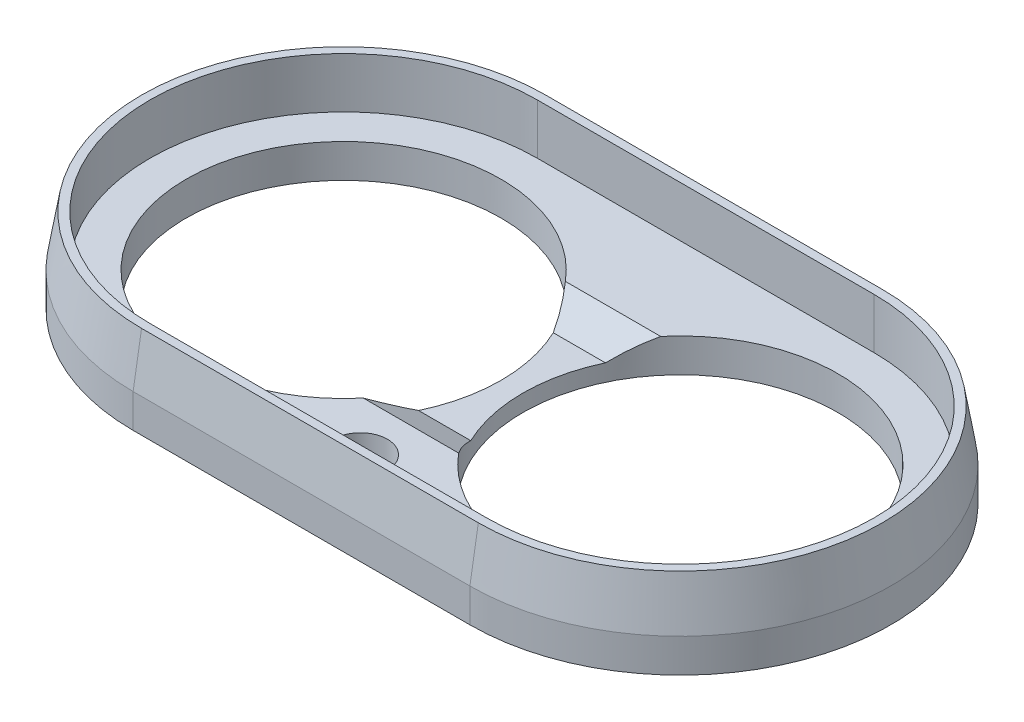
from build123d import *
from OCP.BRepFilletAPI import BRepFilletAPI_MakeChamfer

# Parameters (mm, degrees)
BOSS_EXTRUDE1_DEPTH = 2
SKETCH2_R           = 9.349999999999996
CUT_EXTRUDE1_DEPTH  = 26.81666128685116
BOSS_EXTRUDE2_DEPTH = 3
CHAMFER1_SIZE       = 3
CHAMFER1_SIZE2      = 0.5
SKETCH4_W           = 15.000000000000002
SKETCH4_H           = 12
CUT_EXTRUDE2_DEPTH  = 1
CHAMFER2_SIZE       = 1
CHAMFER2_SIZE_2     = 2
SKETCH5_R           = 1.6000000000000005
SKETCH5_R_2         = 0.75
SKETCH5_R_3         = 0.7500000000000004
CUT_EXTRUDE3_DEPTH  = 27.22022120425378


with BuildPart() as part:
    # Sketch1 → Boss-Extrude1 (new body)
    with BuildSketch(Plane(origin=(0, 0, 0), x_dir=(1, 0, 0), z_dir=(0, 1, 0))):
        with BuildLine():
            Line((-22.5, 0), (-10, 0))
            Line((-10, 0), (1.421e-14, 0))
            Line((1.351e-14, 0), (-3.6e-16, 12.499999999999996))
            Line((0, 12.499999999999996), (-9.999999999999998, 12.499999999999996))
            ThreePointArc((-10.000000000000007, 12.499999999999996), (-18.83883476483184, 8.83883476483184), (-22.499999999999993, 7.9e-16))
        make_face()
        with BuildLine():
            Line((1.421e-14, 0), (-10, 0))
            Line((-10, 0), (-22.5, 0))
            ThreePointArc((-22.499999999999993, 7.9e-16), (-18.83883476483183, -8.83883476483185), (-9.999999999999972, -12.499999999999993))
            Line((-9.999999999999973, -12.499999999999996), (2.665e-14, -12.499999999999996))
            Line((2.739e-14, -12.499999999999996), (1.351e-14, 0))
        make_face()
        with BuildLine():
            Line((10, 0), (1.421e-14, 0))
            Line((1.351e-14, 0), (2.739e-14, -12.499999999999996))
            Line((2.665e-14, -12.499999999999996), (10.000000000000012, -12.499999999999996))
            ThreePointArc((10.000000000000012, -12.499999999999995), (18.838834764831844, -8.838834764831835), (22.499999999999993, 1.01e-15))
            Line((22.5, 0), (10, 0))
        make_face()
        with BuildLine():
            Line((-3.6e-16, 12.499999999999996), (1.351e-14, 0))
            Line((1.421e-14, 0), (10, 0))
            Line((10, 0), (22.5, 0))
            ThreePointArc((22.499999999999993, 1.01e-15), (18.83883476483184, 8.83883476483184), (10, 12.499999999999995))
            Line((9.999999999999998, 12.499999999999996), (0, 12.499999999999996))
        make_face()
    extrude(amount=BOSS_EXTRUDE1_DEPTH)

    # Sketch2 → Cut-Extrude1 (cut, through all)
    with BuildSketch(Plane(origin=(0, 2, 0), x_dir=(1, 0, 0), z_dir=(0, 1, 0))):
        with Locations(Location((10, 0, 0), (0, 0, 270))):
            Circle(SKETCH2_R)
        with Locations(Location((-10, 0, 0), (0, 0, 90))):
            Circle(SKETCH2_R)
    extrude(amount=-CUT_EXTRUDE1_DEPTH, mode=Mode.SUBTRACT)

    # Sketch3 → Boss-Extrude2 (add)
    with BuildSketch(Plane(origin=(0, 2, 0), x_dir=(1, 0, 0), z_dir=(0, 1, 0))):
        with BuildLine():
            Line((-9.99999999999998, -12.499999999999996), (10.000000000000009, -12.499999999999996))
            ThreePointArc((10.000000000000009, -12.499999999999996), (22.499999999999996, 2.78e-15), (10, 12.499999999999996))
            Line((10, 12.499999999999996), (-9.999999999999998, 12.499999999999996))
            ThreePointArc((-9.999999999999998, 12.499999999999996), (-22.499999999999996, -9.57e-15), (-9.99999999999998, -12.499999999999996))
        make_face()
        with BuildLine():
            Line((9.999999999999998, 11.499999999999996), (-9.999999999999998, 11.499999999999996))
            ThreePointArc((-9.999999999999998, 11.499999999999996), (-21.499999999999996, -8.81e-15), (-9.99999999999998, -11.499999999999996))
            Line((-9.99999999999998, -11.499999999999996), (10.000000000000012, -11.499999999999996))
            ThreePointArc((10.000000000000012, -11.499999999999996), (21.499999999999996, 7.66e-15), (9.999999999999998, 11.499999999999996))
        make_face(mode=Mode.SUBTRACT)
    extrude(amount=BOSS_EXTRUDE2_DEPTH)

    # Chamfer1: one chamfer whose edges measure the first distance from different faces: ONE call of the kernel's chamfer builder (chamfer() names one face for all edges)
    chamfer1_edges_1 = [part.edges().sort_by_distance(p)[0] for p in [
        (22.5, 5, -1.79e-15),
    ]]
    chamfer1_side_1 = [part.faces().sort_by_distance(p)[0] for p in [
        (22.499999999999993, 2.5, -1.478e-14),
    ]]
    chamfer1_edges_2 = [part.edges().sort_by_distance(p)[0] for p in [
        (0, 5, -12.499999999999996),
    ]]
    chamfer1_side_2 = [part.faces().sort_by_distance(p)[0] for p in [
        (-4.6e-16, 2.5, -12.499999999999996),
    ]]
    chamfer1_edges_3 = [part.edges().sort_by_distance(p)[0] for p in [
        (-22.499999999999993, 5, 1.178e-14),
    ]]
    chamfer1_side_3 = [part.faces().sort_by_distance(p)[0] for p in [
        (-22.499999999999993, 2.5, 1.611e-14),
    ]]
    chamfer1_edges_4 = [part.edges().sort_by_distance(p)[0] for p in [
        (1.421e-14, 5, 12.499999999999996),
    ]]
    chamfer1_side_4 = [part.faces().sort_by_distance(p)[0] for p in [
        (1.744e-14, 2.5, 12.499999999999996),
    ]]
    chamfer1 = BRepFilletAPI_MakeChamfer(part.part.solid().wrapped)
    for e in chamfer1_edges_1:
        chamfer1.Add(CHAMFER1_SIZE, CHAMFER1_SIZE2, e.wrapped, chamfer1_side_1[0].wrapped)  # the first distance lies on this face
    for e in chamfer1_edges_2:
        chamfer1.Add(CHAMFER1_SIZE, CHAMFER1_SIZE2, e.wrapped, chamfer1_side_2[0].wrapped)  # the first distance lies on this face
    for e in chamfer1_edges_3:
        chamfer1.Add(CHAMFER1_SIZE, CHAMFER1_SIZE2, e.wrapped, chamfer1_side_3[0].wrapped)  # the first distance lies on this face
    for e in chamfer1_edges_4:
        chamfer1.Add(CHAMFER1_SIZE, CHAMFER1_SIZE2, e.wrapped, chamfer1_side_4[0].wrapped)  # the first distance lies on this face
    add(Compound.cast(chamfer1.Shape()), mode=Mode.REPLACE)

    # Sketch4 → Cut-Extrude2 (cut)
    with BuildSketch(Plane(origin=(0, 2, 0), x_dir=(1, 0, 0), z_dir=(0, 1, 0))):
        Rectangle(SKETCH4_W, SKETCH4_H)
    extrude(amount=-CUT_EXTRUDE2_DEPTH, mode=Mode.SUBTRACT)

    # Chamfer2
    chamfer2_edges_1 = [part.edges().sort_by_distance(p)[0] for p in [
        (-8.9e-16, 1, 6),
    ]]
    chamfer2_side_1 = [part.faces().sort_by_distance(p)[0] for p in [
        (-8.9e-16, 1.02, 6),
    ]]
    chamfer2_edges_2 = [part.edges().sort_by_distance(p)[0] for p in [
        (8.9e-16, 1, -6),
    ]]
    chamfer2_side_2 = [part.faces().sort_by_distance(p)[0] for p in [
        (8.9e-16, 1, -5.98),
    ]]
    chamfer2 = BRepFilletAPI_MakeChamfer(part.part.solid().wrapped)
    for e in chamfer2_edges_1:
        chamfer2.Add(CHAMFER2_SIZE - 0.0001, CHAMFER2_SIZE_2 - 0.0001, e.wrapped, chamfer2_side_1[0].wrapped)
    for e in chamfer2_edges_2:
        chamfer2.Add(CHAMFER2_SIZE_2 - 0.0001, CHAMFER2_SIZE - 0.0001, e.wrapped, chamfer2_side_2[0].wrapped)
    add(Compound.cast(chamfer2.Shape()), mode=Mode.REPLACE)  # a hair under: the kernel refuses the full size

    # Sketch5 → Cut-Extrude3 (cut, through all)
    with BuildSketch(Plane.XZ):
        with Locations(Location((0, 8.999999999999998, 0), (0, 0, 270))):
            Circle(SKETCH5_R)
        with Locations(Location((-4.000000000000002, 9.499999999999998, 0), (0, 0, 270))):
            Circle(SKETCH5_R_2)
        with Locations(Location((3.9999999999999982, 9.499999999999998, 0), (0, 0, 270))):
            Circle(SKETCH5_R_3)
    extrude(amount=-CUT_EXTRUDE3_DEPTH, mode=Mode.SUBTRACT)


solid = part.part
